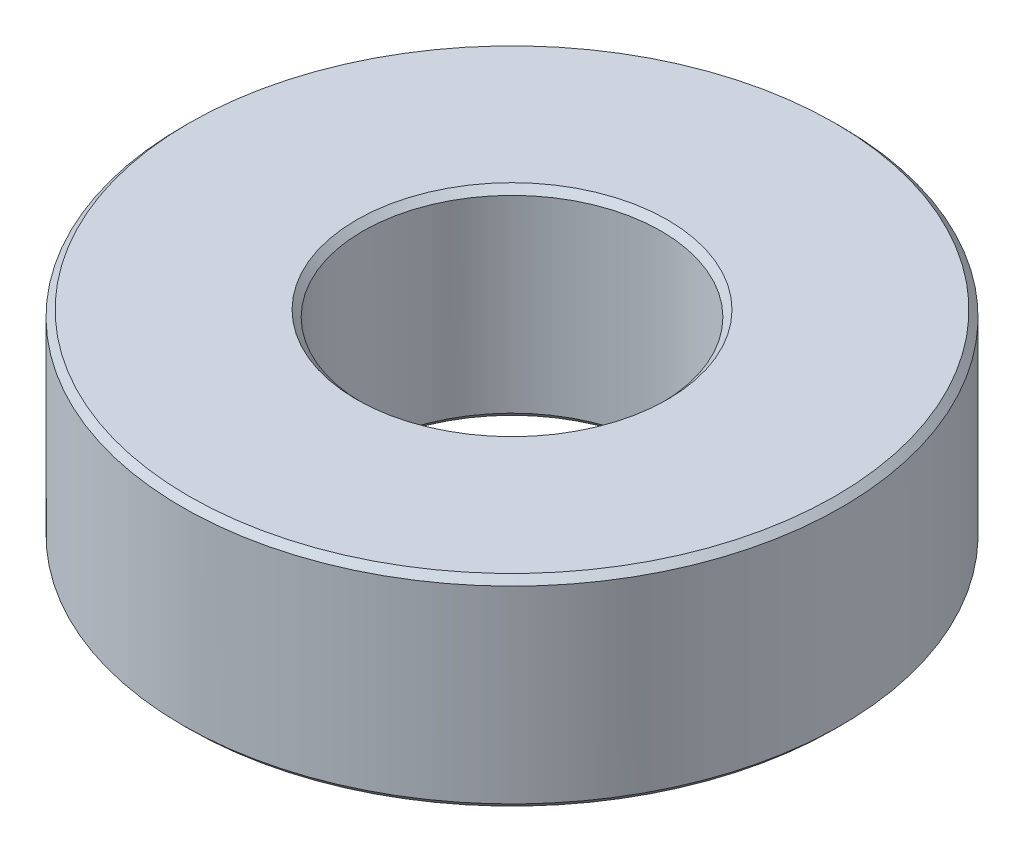
from build123d import *

# Parameters (mm, degrees)
SKETCH1_R           = 22.5
BOSS_EXTRUDE1_DEPTH = 13.756680578
SKETCH2_R           = 10.181346135
CUT_EXTRUDE1_DEPTH  = 35.666212088
CHAMFER1_SIZE       = 0.439516896


with BuildPart() as part:
    # Sketch1 → Boss-Extrude1 (new body)
    with BuildSketch(Plane(origin=(0, 0, 0), x_dir=(1, 0, 0), z_dir=(0, 1, 0))):
        Circle(SKETCH1_R)
    extrude(amount=BOSS_EXTRUDE1_DEPTH)

    # Sketch2 → Cut-Extrude1 (cut, through all)
    with BuildSketch(Plane(origin=(0, 0, 0), x_dir=(1, 0, 0), z_dir=(0, 1, 0))):
        Circle(SKETCH2_R)
    extrude(amount=CUT_EXTRUDE1_DEPTH, mode=Mode.SUBTRACT)

    # Chamfer1
    chamfer1_edges = [part.edges().sort_by_distance(p)[0] for p in [
        (-10.181346135, 13.756680578, 0),
        (-10.181346135, 0, 0),
        (-22.5, 0, 0),
        (-22.5, 13.756680578, 0),
    ]]
    chamfer(chamfer1_edges, length=CHAMFER1_SIZE)


solid = part.part
